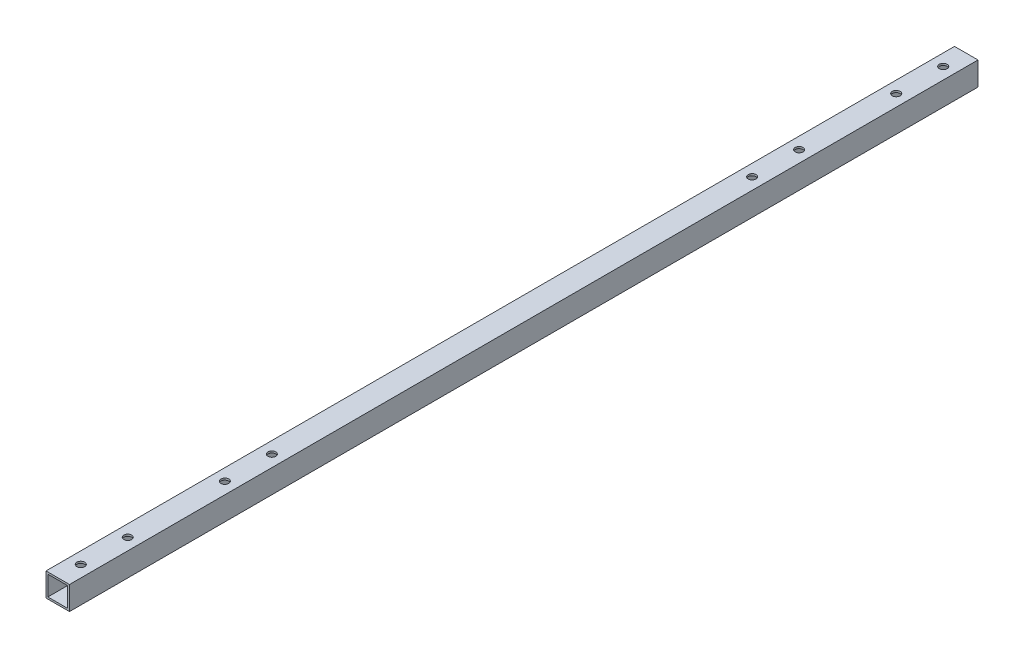
from build123d import *

# Parameters (mm, degrees)
SKETCH_1_W          = 15
SKETCH_1_H          = 15
SKETCH_1_W_2        = 12.6
SKETCH_1_H_2        = 12.6
EXTRUDE_1_DEPTH     = 570
SKETCH_4_W          = 15
SKETCH_4_H          = 15
SKETCH_4_W_2        = 12.6
SKETCH_4_H_2        = 12.6
EXTRUDE_2_DEPTH     = 10
SKETCH_2_R          = 2.5
CUT_EXTRUDE_1_DEPTH = 25


with BuildPart() as part:
    # 草图1 → 凸台-拉伸1 (new body)
    with BuildSketch(Plane.XY):
        Rectangle(SKETCH_1_W, SKETCH_1_H)
        Rectangle(SKETCH_1_W_2, SKETCH_1_H_2, mode=Mode.SUBTRACT)
    extrude(amount=EXTRUDE_1_DEPTH)

    # 草图4 → 凸台-拉伸2 (add)
    with BuildSketch(Plane.XY.offset(570)):
        Rectangle(SKETCH_4_W, SKETCH_4_H)
        Rectangle(SKETCH_4_W_2, SKETCH_4_H_2, mode=Mode.SUBTRACT)
    extrude(amount=EXTRUDE_2_DEPTH)

    # 草图2 → 切除-拉伸1 (cut)
    with BuildSketch(Plane.XZ.offset(7.5)):
        with Locations((0, 565.303127886)):
            Circle(SKETCH_2_R)
        with Locations((0, 535.303127886)):
            Circle(SKETCH_2_R)
        with Locations((0, 473.303127886)):
            Circle(SKETCH_2_R)
        with Locations((0, 443.303127886)):
            Circle(SKETCH_2_R)
    cut_extrude_1 = extrude(amount=-CUT_EXTRUDE_1_DEPTH, mode=Mode.SUBTRACT)

    # 镜向1: 切除-拉伸1 across plane
    add(cut_extrude_1.mirror(Plane.XY.offset(290)), mode=Mode.SUBTRACT)


solid = part.part
